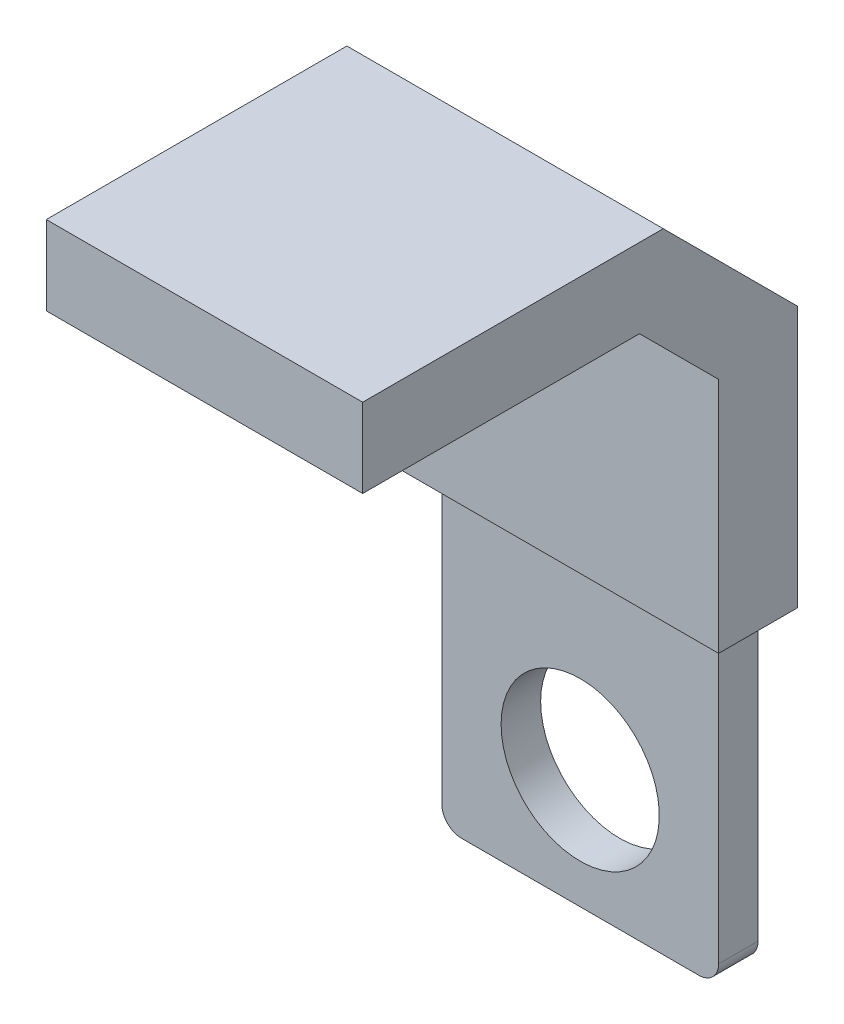
from build123d import *

# Parameters (mm, degrees)
SZKIC1_W                    = 4
SZKIC1_H                    = 1
DODANIE_WYCI_GNI_CIE5_DEPTH = 5
SZKIC6_W                    = 4
SZKIC6_H                    = 1
DODANIE_WYCI_GNI_CIE6_DEPTH = 4.5
SFAZOWANIE2_SIZE            = 1
SFAZOWANIE4_SIZE            = 1.7
SZKIC13_W                   = 3.5
SZKIC13_H                   = 0.5
DODANIE_WYCI_GNI_CIE7_DEPTH = 3.9
ZAOKR_GLENIE1_R             = 0.25
SZKIC14_R                   = 1
WYTNIJ_WYCI_GNI_CIE1_DEPTH  = 3.9
ZAOKR_GLENIE2_R             = 0.25


with BuildPart() as part:
    # Szkic1 → Dodanie-wyciągnięcie5 (new body)
    with BuildSketch(Plane(origin=(0, 0, 0), x_dir=(1, 0, 0), z_dir=(0, 1, 0))):
        Rectangle(SZKIC1_W, SZKIC1_H)
    extrude(amount=DODANIE_WYCI_GNI_CIE5_DEPTH)

    # Szkic6 → Dodanie-wyciągnięcie6 (add)
    with BuildSketch(Plane.XY.offset(0.5)):
        with Locations((0, 4.5)):
            Rectangle(SZKIC6_W, SZKIC6_H)
    extrude(amount=DODANIE_WYCI_GNI_CIE6_DEPTH)

    # Sfazowanie2
    sfazowanie2_edges = [part.edges().sort_by_distance(p)[0] for p in [
        (0, 4, 0.5),
    ]]
    chamfer(sfazowanie2_edges, length=SFAZOWANIE2_SIZE)

    # Sfazowanie4
    sfazowanie4_edges = [part.edges().sort_by_distance(p)[0] for p in [
        (0, 5, -0.5),
    ]]
    chamfer(sfazowanie4_edges, length=SFAZOWANIE4_SIZE)

    # Szkic13 → Dodanie-wyciągnięcie7 (add)
    with BuildSketch(Plane.XZ):
        Rectangle(SZKIC13_W, SZKIC13_H)
    extrude(amount=DODANIE_WYCI_GNI_CIE7_DEPTH)

    # Zaokrąglenie1
    zaokr_glenie1_edges = [part.edges().sort_by_distance(p)[0] for p in [
        (-1.75, 0, 0),
        (0, 0, -0.25),
        (1.75, 0, 0),
        (0, 0, 0.25),
    ]]
    fillet(zaokr_glenie1_edges, radius=ZAOKR_GLENIE1_R - 0.0001)  # a hair under: the kernel refuses the full size

    # Szkic14 → Wytnij-wyciągnięcie1 (cut)
    with BuildSketch(Plane(origin=(0, 0, -0.25), x_dir=(-1, 0, 0), z_dir=(0, 0, -1))):
        with Locations((0, -2.400763045)):
            Circle(SZKIC14_R)
    extrude(amount=-WYTNIJ_WYCI_GNI_CIE1_DEPTH, mode=Mode.SUBTRACT)

    # Zaokrąglenie2
    zaokr_glenie2_edges = [part.edges().sort_by_distance(p)[0] for p in [
        (-1.75, -3.9, 0),
        (1.75, -3.9, 0),
    ]]
    fillet(zaokr_glenie2_edges, radius=ZAOKR_GLENIE2_R)


solid = part.part
